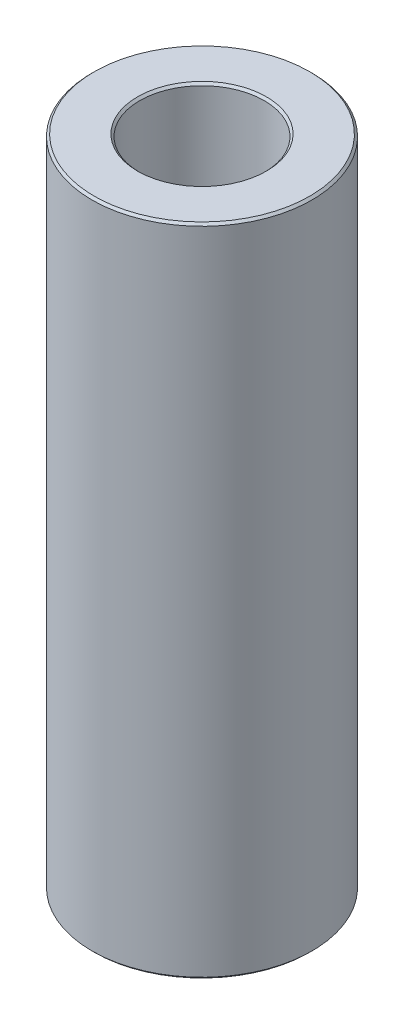
from build123d import *

# Parameters (mm, degrees)
SKETCH1_R           = 42.5
BOSS_EXTRUDE1_DEPTH = 252.979951957
SKETCH2_R           = 24.042249317
CUT_EXTRUDE1_DEPTH  = 261.021837722
CHAMFER1_SIZE       = 0.854161998


with BuildPart() as part:
    # Sketch1 → Boss-Extrude1 (new body)
    with BuildSketch(Plane(origin=(0, 0, 0), x_dir=(1, 0, 0), z_dir=(0, 1, 0))):
        Circle(SKETCH1_R)
    extrude(amount=BOSS_EXTRUDE1_DEPTH)

    # Sketch2 → Cut-Extrude1 (cut, through all)
    with BuildSketch(Plane(origin=(0, 0, 0), x_dir=(1, 0, 0), z_dir=(0, 1, 0))):
        Circle(SKETCH2_R)
    extrude(amount=CUT_EXTRUDE1_DEPTH, mode=Mode.SUBTRACT)

    # Chamfer1
    chamfer1_edges = [part.edges().sort_by_distance(p)[0] for p in [
        (-24.042249317, 252.979951957, 0),
        (-24.042249317, 0, 0),
        (-42.5, 0, 0),
        (-42.5, 252.979951957, 0),
    ]]
    chamfer(chamfer1_edges, length=CHAMFER1_SIZE)


solid = part.part
